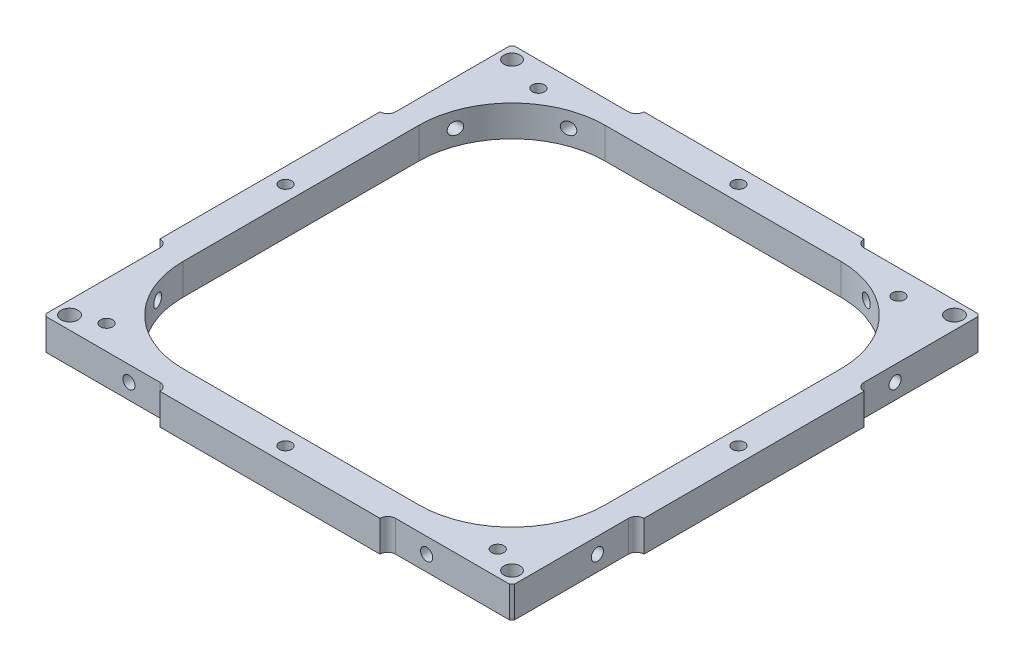
from build123d import *

# Parameters (mm, degrees)
BOSS_EXTRUDE1_DEPTH            = 6.35
CHAMFER1_SIZE                  = 0.508
FILLET1_R                      = 1.5875
F_8_36_TAPPED_HOLE2_D          = 3.4544
M3X0_5_TAPPED_HOLE1_AT_2_COUNT = 2
M3X0_5_TAPPED_HOLE1_AT_2_PITCH = 60.9
CIRPATTERN1_COUNT              = 4
SKETCH9_R                      = 0.79375
CUT_EXTRUDE2_DEPTH             = 71.290984486
CUT_EXTRUDE3_DEPTH             = 71.290984486
CIRPATTERN2_COUNT              = 4
M4X0_7_TAPPED_HOLE1_D          = 3.3
M3X0_5_TAPPED_HOLE4_D          = 2.5


with BuildPart() as part:
    # Sketch1 → Boss-Extrude1 (new body)
    with BuildSketch(Plane(origin=(0, 0, 0), x_dir=(1, 0, 0), z_dir=(0, 1, 0))):
        Polygon((-47.9125, 22.5125), (-49.5, 22.5125), (-49.5, -22.5125), (-47.9125, -22.5125), (-47.9125, -47.9125), (-22.5125, -47.9125), (-22.5125, -49.5), (22.5125, -49.5), (22.5125, -47.9125), (47.9125, -47.9125), (47.9125, -22.5125), (49.5, -22.5125), (49.5, 22.5125), (47.9125, 22.5125), (47.9125, 47.9125), (22.5125, 47.9125), (22.5125, 49.5), (-22.5125, 49.5), (-22.5125, 47.9125), (-47.9125, 47.9125), align=None)
    extrude(amount=BOSS_EXTRUDE1_DEPTH)

    # Chamfer1
    chamfer1_edges = [part.edges().sort_by_distance(p)[0] for p in [
        (-47.9125, 3.175, -47.9125),
        (47.9125, 3.175, -47.9125),
        (47.9125, 3.175, 47.9125),
        (-47.9125, 3.175, 47.9125),
    ]]
    chamfer(chamfer1_edges, length=CHAMFER1_SIZE)

    # Fillet1
    fillet1_edges = [part.edges().sort_by_distance(p)[0] for p in [
        (-47.9125, 3.175, -22.5125),
        (-22.5125, 3.175, -47.9125),
        (22.5125, 3.175, -47.9125),
        (47.9125, 3.175, -22.5125),
        (47.9125, 3.175, 22.5125),
        (22.5125, 3.175, 47.9125),
        (-22.5125, 3.175, 47.9125),
        (-47.9125, 3.175, 22.5125),
    ]]
    fillet(fillet1_edges, radius=FILLET1_R - 0.0001)  # a hair under: the kernel refuses the full size

    # #8-36 Tapped Hole2 (through all)
    with Locations(Plane(origin=(0, 0, 0), x_dir=(-1, 0, 0), z_dir=(0, -1, 0))):
        with Locations((-45.25, 45.25), (45.25, -45.25)):
            Hole(F_8_36_TAPPED_HOLE2_D / 2)

    # Sketch7 → M3x0.5 Tapped Hole1 (revolve, cut)
    with BuildSketch(Plane(origin=(-30.45, 3.175, 47.9125), x_dir=(0, -1, 0), z_dir=(1, 0, 0))):
        Polygon((0, 0), (0, 8.371075774), (1.25, 7.62), (1.25, 0), align=None)
    m3x0_5_tapped_hole1 = revolve(axis=Axis((-30.45, 3.175, 54.2625), (0, 0, -1)), mode=Mode.SUBTRACT)

    # M3x0.5 Tapped Hole1 at 2: M3x0.5 Tapped Hole1 ×2
    with Locations(*[(i * M3X0_5_TAPPED_HOLE1_AT_2_PITCH, 0, 0) for i in range(1, M3X0_5_TAPPED_HOLE1_AT_2_COUNT)]):
        add(m3x0_5_tapped_hole1, mode=Mode.SUBTRACT)

    # CirPattern1: M3x0.5 Tapped Hole1 ×4 about axis
    cirpattern1_axis = Axis((0, -0.3175, 0), (0, 1, 0))
    for i in range(1, CIRPATTERN1_COUNT):
        add(m3x0_5_tapped_hole1.rotate(cirpattern1_axis, i * 360 / CIRPATTERN1_COUNT), mode=Mode.SUBTRACT)

    # CirPattern1 copy 1 sketch → CirPattern1 copy 1 (revolve, cut)
    with BuildSketch(Plane(origin=(47.9125, 3.175, -30.45), x_dir=(0, -1, 0), z_dir=(0, 0, -1))):
        Polygon((0, 0), (0, 8.371075774), (1.25, 7.62), (1.25, 0), align=None)
    revolve(axis=Axis((54.2625, 3.175, -30.45), (-1, 0, 0)), mode=Mode.SUBTRACT)

    # CirPattern1 copy 2 sketch → CirPattern1 copy 2 (revolve, cut)
    with BuildSketch(Plane(origin=(-30.45, 3.175, -47.9125), x_dir=(0, -1, 0), z_dir=(-1, 0, 0))):
        Polygon((0, 0), (0, 8.371075774), (1.25, 7.62), (1.25, 0), align=None)
    revolve(axis=Axis((-30.45, 3.175, -54.2625), (0, 0, 1)), mode=Mode.SUBTRACT)

    # CirPattern1 copy 3 sketch → CirPattern1 copy 3 (revolve, cut)
    with BuildSketch(Plane(origin=(-47.9125, 3.175, 30.45), x_dir=(0, -1, 0), z_dir=(0, 0, 1))):
        Polygon((0, 0), (0, 8.371075774), (1.25, 7.62), (1.25, 0), align=None)
    revolve(axis=Axis((-54.2625, 3.175, 30.45), (1, 0, 0)), mode=Mode.SUBTRACT)

    # Sketch9 → Cut-Extrude2 (cut, through all)
    with BuildSketch(Plane(origin=(0, 6.35, 0), x_dir=(1, 0, 0), z_dir=(0, 1, 0))):
        with Locations(Location((-40.005, -42.926, 0), (0, 0, 270))):
            Circle(SKETCH9_R)
        with Locations(Location((40.005, -42.926, 0), (0, 0, 270))):
            Circle(SKETCH9_R)
        with Locations(Location((36.195, 42.8625, 0), (0, 0, 270))):
            Circle(SKETCH9_R)
        with Locations(Location((-37.465, 42.8625, 0), (0, 0, 270))):
            Circle(SKETCH9_R)
    extrude(amount=-CUT_EXTRUDE2_DEPTH, mode=Mode.SUBTRACT)

    # Sketch15 → M3x0.5 Tapped Hole3 (revolve, cut)
    with BuildSketch(Plane(origin=(0, 6.35, 46.325), x_dir=(0, 0, 1), z_dir=(1, 0, 0))):
        Polygon((0, 0), (0, 8.371075774), (1.25, 7.62), (1.25, 0), align=None)
    m3x0_5_tapped_hole3 = revolve(axis=Axis((0, 12.7, 46.325), (0, -1, 0)), mode=Mode.SUBTRACT)

    # Sketch16 → Cut-Extrude3 (cut, through all)
    with BuildSketch(Plane(origin=(0, 6.35, 0), x_dir=(1, 0, 0), z_dir=(0, 1, 0))):
        with BuildLine():
            ThreePointArc((-43.15, -24.1), (-37.570384182, -37.570384182), (-24.1, -43.15))
            Line((-24.1, -43.15), (24.1, -43.15))
            ThreePointArc((24.1, -43.15), (37.570384182, -37.570384182), (43.15, -24.1))
            Line((43.15, -24.1), (43.15, 24.1))
            ThreePointArc((43.15, 24.1), (37.570384182, 37.570384182), (24.1, 43.15))
            Line((24.1, 43.15), (-24.1, 43.15))
            ThreePointArc((-24.1, 43.15), (-37.570384182, 37.570384182), (-43.15, 24.1))
            Line((-43.15, 24.1), (-43.15, -24.1))
        make_face()
    extrude(amount=-CUT_EXTRUDE3_DEPTH, mode=Mode.SUBTRACT)

    # CirPattern2: M3x0.5 Tapped Hole3 ×4 about axis
    cirpattern2_axis = Axis((0, 0, 0), (0, 1, 0))
    for i in range(1, CIRPATTERN2_COUNT):
        add(m3x0_5_tapped_hole3.rotate(cirpattern2_axis, i * 360 / CIRPATTERN2_COUNT), mode=Mode.SUBTRACT)

    # M4x0.7 Tapped Hole1 (through all)
    with Locations(Plane(origin=(0, 6.35, 0), x_dir=(1, 0, 0), z_dir=(0, 1, 0))):
        with Locations((-45.25, 45.25), (45.25, -45.25)):
            Hole(M4X0_7_TAPPED_HOLE1_D / 2)

    # M3x0.5 Tapped Hole4 (through all)
    with Locations(Plane(origin=(0, 6.35, 0), x_dir=(1, 0, 0), z_dir=(0, 1, 0))):
        with Locations((36.195, 42.8625), (-37.465, 42.8625), (-40.005, -42.926), (40.005, -42.926)):
            Hole(M3X0_5_TAPPED_HOLE4_D / 2)


solid = part.part
